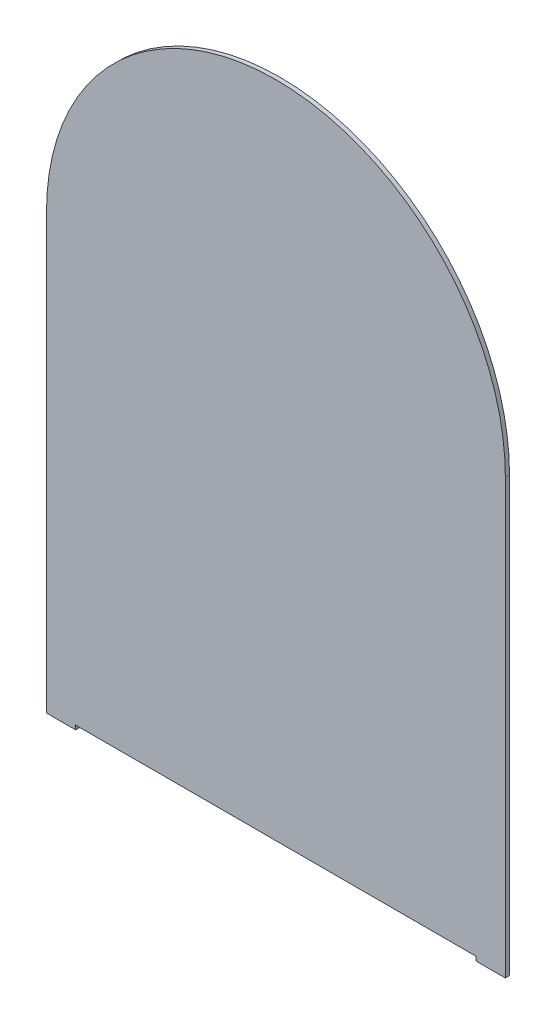
from build123d import *

# Parameters (mm, degrees)
BOSS_EXTRUDE1_DEPTH = 3.175
SKETCH2_W           = 304.8
SKETCH2_H           = 3.175
CUT_EXTRUDE1_DEPTH  = 3.175


with BuildPart() as part:
    # Sketch1 → Boss-Extrude1 (new body)
    with BuildSketch(Plane.XY):
        with BuildLine():
            Line((0, 0), (0, -330.2))
            Line((0, -330.2), (349.25, -330.2))
            Line((349.25, -330.2), (349.25, 0))
            ThreePointArc((349.25, 0), (174.625, 174.625), (0, 0))
        make_face()
    extrude(amount=BOSS_EXTRUDE1_DEPTH)

    # Sketch2 → Cut-Extrude1 (cut)
    with BuildSketch(Plane.XY.offset(3.175)):
        with Locations((174.625, -328.6125)):
            Rectangle(SKETCH2_W, SKETCH2_H)
    extrude(amount=-CUT_EXTRUDE1_DEPTH, mode=Mode.SUBTRACT)


solid = part.part
